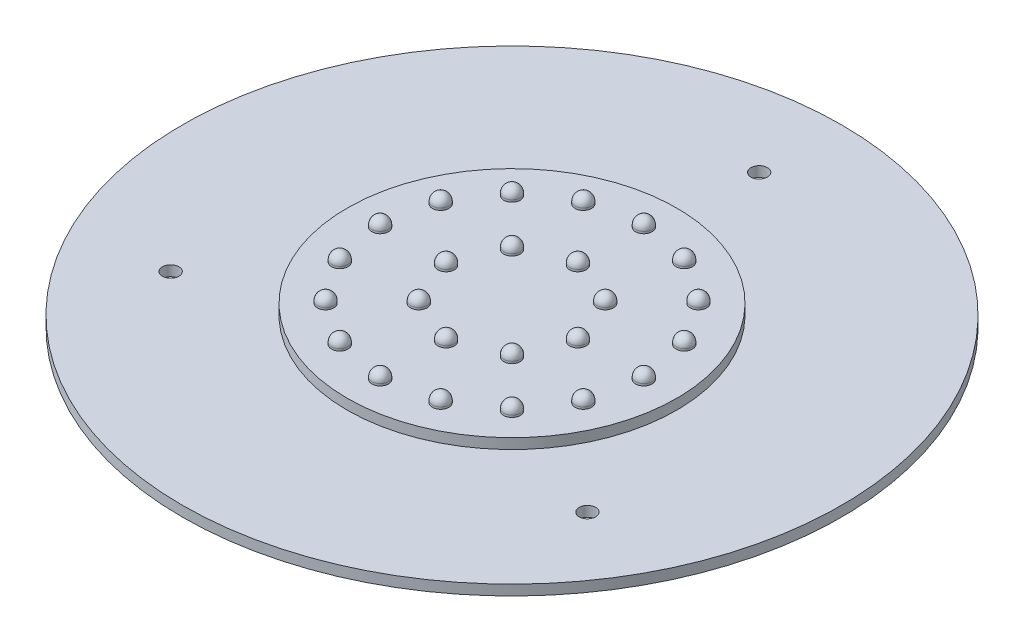
from build123d import *

# Parameters (mm, degrees)
SKETCH_1_R      = 80
EXTRUDE_1_DEPTH = 5
SKETCH_2_R      = 160
EXTRUDE_2_DEPTH = 5
MM_1_D          = 8
MM_1_DEPTH      = 10
MM_1_TIP        = 2.403442476
SKETCH_6_R      = 4
EXTRUDE_3_DEPTH = 5
FILLET_1_R      = 4
SKETCH_8_R      = 4
EXTRUDE_4_DEPTH = 5
FILLET_2_R      = 4


with BuildPart() as part:
    # 草图1 → 凸台-拉伸1 (new body)
    with BuildSketch(Plane(origin=(0, 0, 0), x_dir=(1, 0, 0), z_dir=(0, 1, 0))):
        Circle(SKETCH_1_R)
    extrude(amount=EXTRUDE_1_DEPTH)

    # 草图2 → 凸台-拉伸2 (add)
    with BuildSketch(Plane(origin=(0, 0, 0), x_dir=(1, 0, 0), z_dir=(0, 1, 0))):
        Circle(SKETCH_2_R)
    extrude(amount=-EXTRUDE_2_DEPTH)

    # 大小mm 暗销孔1
    with Locations(Plane(origin=(0, 0, -120), x_dir=(0, 0, 1), z_dir=(0, 1, 0))):
        with Locations((0, 0), (184.550425689, -101.159490624), (184.550425689, 101.159490624)):
            Hole(MM_1_D / 2, depth=MM_1_DEPTH)
            with Locations((0, 0, -(MM_1_DEPTH + MM_1_TIP / 2))):  # 118° drill point
                Cone(0, MM_1_D / 2, MM_1_TIP, mode=Mode.SUBTRACT)

    # 草图6 → 凸台-拉伸3 (add)
    with BuildSketch(Plane(origin=(0, 5, 0), x_dir=(1, 0, 0), z_dir=(0, 1, 0))):
        with Locations((0, 64)):
            Circle(SKETCH_6_R)
        with Locations((24.491739671, 59.128290081)):
            Circle(SKETCH_6_R)
        with Locations((45.254833996, 45.254833996)):
            Circle(SKETCH_6_R)
        with Locations((59.128290081, 24.491739671)):
            Circle(SKETCH_6_R)
        with Locations((64, 0)):
            Circle(SKETCH_6_R)
        with Locations((59.128290081, -24.491739671)):
            Circle(SKETCH_6_R)
        with Locations((45.254833996, -45.254833996)):
            Circle(SKETCH_6_R)
        with Locations((24.491739671, -59.128290081)):
            Circle(SKETCH_6_R)
        with Locations((0, -64)):
            Circle(SKETCH_6_R)
        with Locations((-24.491739671, -59.128290081)):
            Circle(SKETCH_6_R)
        with Locations((-45.254833996, -45.254833996)):
            Circle(SKETCH_6_R)
        with Locations((-59.128290081, -24.491739671)):
            Circle(SKETCH_6_R)
        with Locations((-64, 0)):
            Circle(SKETCH_6_R)
        with Locations((-59.128290081, 24.491739671)):
            Circle(SKETCH_6_R)
        with Locations((-45.254833996, 45.254833996)):
            Circle(SKETCH_6_R)
        with Locations((-24.491739671, 59.128290081)):
            Circle(SKETCH_6_R)
    extrude(amount=EXTRUDE_3_DEPTH)

    # 圆角1
    fillet_1_edges = [part.edges().sort_by_distance(p)[0] for p in [
        (55.128290081, 10, -24.491739671),
        (41.254833996, 10, -45.254833996),
        (60, 10, 0),
        (55.128290081, 10, 24.491739671),
        (41.254833996, 10, 45.254833996),
        (20.491739671, 10, 59.128290081),
        (-4, 10, 64),
        (-28.491739671, 10, 59.128290081),
        (-49.254833996, 10, 45.254833996),
        (-63.128290081, 10, 24.491739671),
        (-68, 10, 0),
        (-63.128290081, 10, -24.491739671),
        (-49.254833996, 10, -45.254833996),
        (-28.491739671, 10, -59.128290081),
        (-4, 10, -64),
        (20.491739671, 10, -59.128290081),
    ]]
    fillet(fillet_1_edges, radius=FILLET_1_R)

    # 草图8 → 凸台-拉伸4 (add)
    with BuildSketch(Plane(origin=(0, 5, 0), x_dir=(1, 0, 0), z_dir=(0, 1, 0))):
        with Locations((0, 32)):
            Circle(SKETCH_8_R)
        with Locations((22.627416998, 22.627416998)):
            Circle(SKETCH_8_R)
        with Locations((32, 0)):
            Circle(SKETCH_8_R)
        with Locations((22.627416998, -22.627416998)):
            Circle(SKETCH_8_R)
        with Locations((0, -32)):
            Circle(SKETCH_8_R)
        with Locations((-22.627416998, -22.627416998)):
            Circle(SKETCH_8_R)
        with Locations((-32, 0)):
            Circle(SKETCH_8_R)
        with Locations((-22.627416998, 22.627416998)):
            Circle(SKETCH_8_R)
    extrude(amount=EXTRUDE_4_DEPTH)

    # 圆角2
    fillet_2_edges = [part.edges().sort_by_distance(p)[0] for p in [
        (-26.627416998, 10, -22.627416998),
        (-36, 10, 0),
        (-26.627416998, 10, 22.627416998),
        (-4, 10, 32),
        (18.627416998, 10, 22.627416998),
        (28, 10, 0),
        (18.627416998, 10, -22.627416998),
        (-4, 10, -32),
    ]]
    fillet(fillet_2_edges, radius=FILLET_2_R)


solid = part.part
